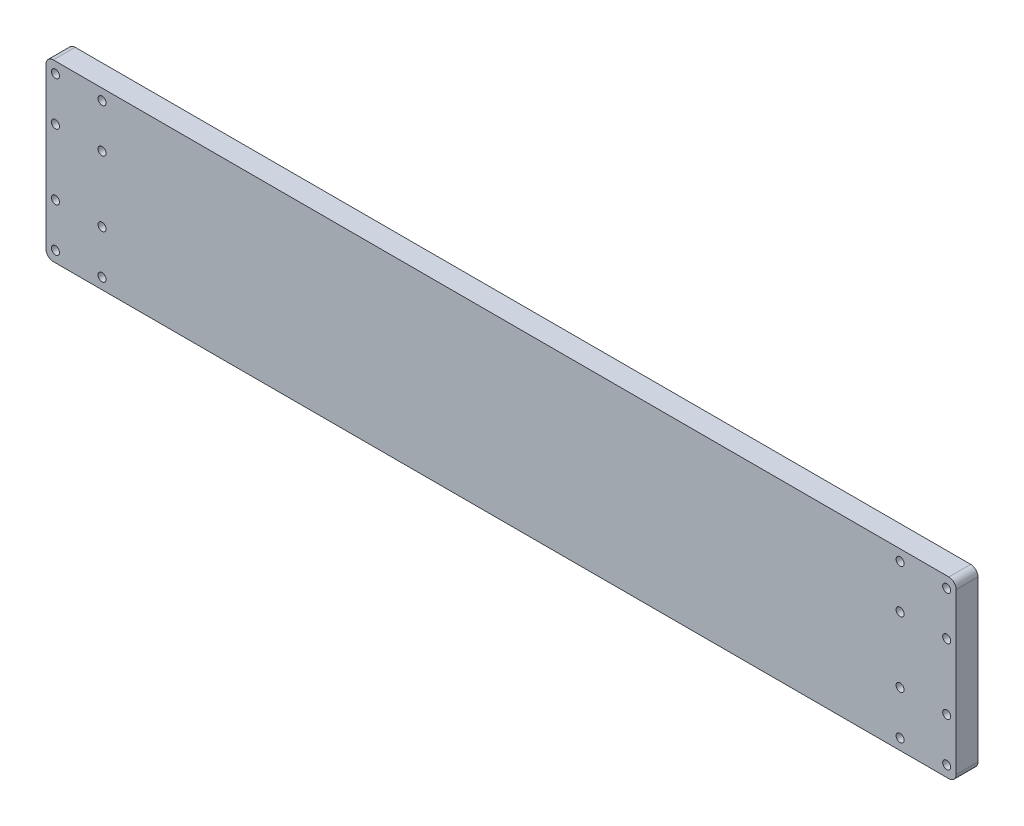
from build123d import *

# Parameters (mm, degrees)
ESQUISSE1_W                  = 625
ESQUISSE1_H                  = 120
BOSS_EXTRU_1_DEPTH           = 15
ENL_V_MAT_EXTRU_1_DEPTH      = 637.592491316
ENL_V_MAT_EXTRU_1_DEPTH_BACK = 637.592491316
ESQUISSE2_R                  = 2.75
CONG_1_R                     = 5


with BuildPart() as part:
    # Esquisse1 → Boss.-Extru.1 (new body)
    with BuildSketch(Plane.XY):
        with Locations((312.5, 60)):
            Rectangle(ESQUISSE1_W, ESQUISSE1_H)
    extrude(amount=BOSS_EXTRU_1_DEPTH)

    # Esquisse2 → Enlèv. mat.-Extru.1 (cut, two sides: drawn at the far end of the back side and taken through both)
    with BuildSketch(Plane.XY.offset(15).offset(-ENL_V_MAT_EXTRU_1_DEPTH_BACK)):
        with Locations((6.5, 112.5)):
            Circle(ESQUISSE2_R)
        with Locations((6.5, 82.5)):
            Circle(ESQUISSE2_R)
        with Locations((38.5, 82.5)):
            Circle(ESQUISSE2_R)
        with Locations((38.5, 112.5)):
            Circle(ESQUISSE2_R)
        with Locations((38.5, 7.5)):
            Circle(ESQUISSE2_R)
        with Locations((38.5, 37.5)):
            Circle(ESQUISSE2_R)
        with Locations((6.5, 37.5)):
            Circle(ESQUISSE2_R)
        with Locations((6.5, 7.5)):
            Circle(ESQUISSE2_R)
        with Locations((618.5, 7.5)):
            Circle(ESQUISSE2_R)
        with Locations((618.5, 37.5)):
            Circle(ESQUISSE2_R)
        with Locations((586.5, 37.5)):
            Circle(ESQUISSE2_R)
        with Locations((586.5, 7.5)):
            Circle(ESQUISSE2_R)
        with Locations((586.5, 112.5)):
            Circle(ESQUISSE2_R)
        with Locations((586.5, 82.5)):
            Circle(ESQUISSE2_R)
        with Locations((618.5, 82.5)):
            Circle(ESQUISSE2_R)
        with Locations((618.5, 112.5)):
            Circle(ESQUISSE2_R)
    extrude(amount=ENL_V_MAT_EXTRU_1_DEPTH + ENL_V_MAT_EXTRU_1_DEPTH_BACK, mode=Mode.SUBTRACT)

    # Congé1
    cong_1_edges = [part.edges().sort_by_distance(p)[0] for p in [
        (625, 120, 7.5),
        (625, 0, 7.5),
        (0, 0, 7.5),
        (0, 120, 7.5),
    ]]
    fillet(cong_1_edges, radius=CONG_1_R)


solid = part.part
